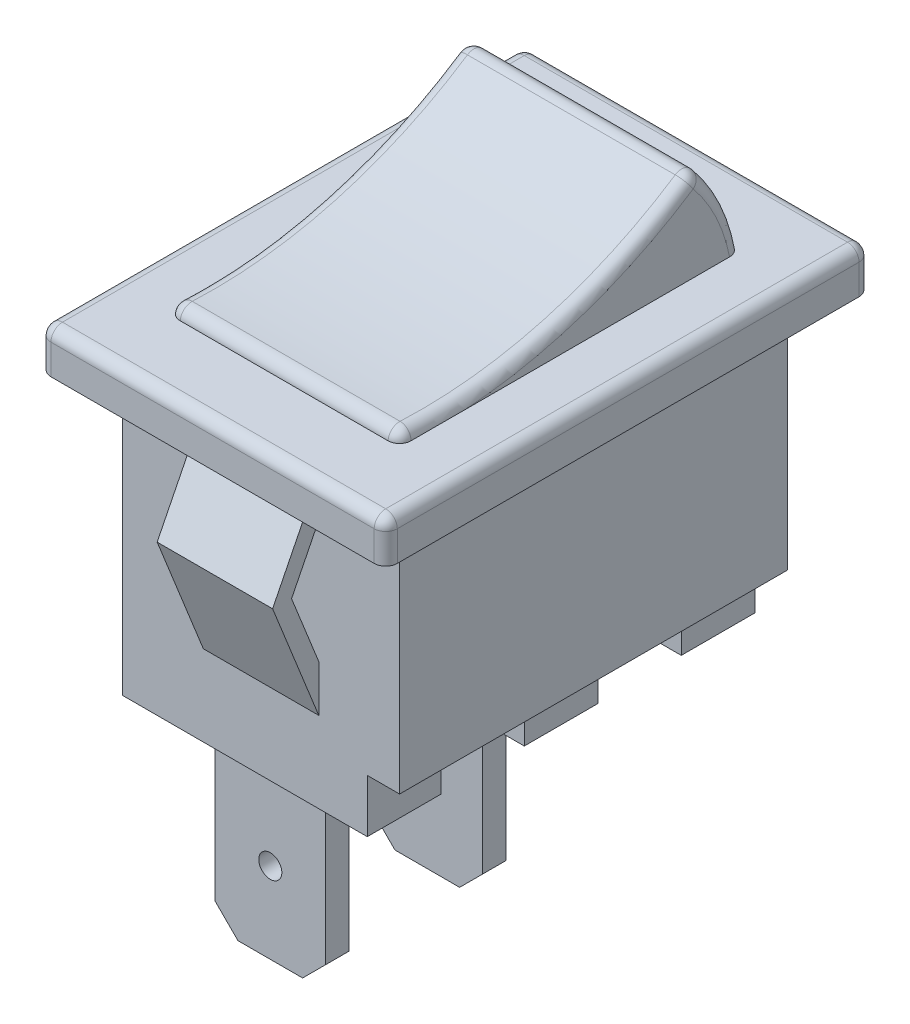
from build123d import *

# Parameters (mm, degrees)
SKETCH1_W           = 15
SKETCH1_H           = 21
BOSS_EXTRUDE1_DEPTH = 1.8
SKETCH2_W           = 12
SKETCH2_H           = 16.8
BOSS_EXTRUDE2_DEPTH = 10.2
SKETCH3_W           = 10.6
SKETCH3_H           = 3.2
SKETCH3_W_2         = 6.5
SKETCH3_H_2         = 1
BOSS_EXTRUDE3_DEPTH = 2.3
SKETCH4_R           = 0.5
BOSS_EXTRUDE4_DEPTH = 1
EXTRUDE_THIN1_DEPTH = 2.5
BOSS_EXTRUDE5_DEPTH = 5
FILLET1_R           = 0.5
FILLET2_R           = 0.5


with BuildPart() as part:
    # Sketch1 → Boss-Extrude1 (new body)
    with BuildSketch(Plane(origin=(0, 0, 0), x_dir=(1, 0, 0), z_dir=(0, 1, 0))):
        Rectangle(SKETCH1_W, SKETCH1_H)
    extrude(amount=BOSS_EXTRUDE1_DEPTH)

    # Sketch2 → Boss-Extrude2 (add)
    with BuildSketch(Plane(origin=(0, 0, 0), x_dir=(1, 0, 0), z_dir=(0, 1, 0))):
        Rectangle(SKETCH2_W, SKETCH2_H)
    extrude(amount=-BOSS_EXTRUDE2_DEPTH)

    # Sketch3 → Boss-Extrude3 (add)
    # profile 1 of 3: a face of its own
    with BuildSketch(Plane.XZ.offset(10.2)):
        with Locations((-0.7, 6.8)):
            Rectangle(SKETCH3_W, SKETCH3_H)
        with Locations((-0.7, 6.8)):
            Rectangle(SKETCH3_W_2, SKETCH3_H_2, mode=Mode.SUBTRACT)
    # profile 2 of 3: a face of its own
    with BuildSketch(Plane.XZ.offset(10.2)):
        with Locations((-0.7, -6.8)):
            Rectangle(SKETCH3_W, SKETCH3_H)
        with Locations((-0.7, -6.8)):
            Rectangle(SKETCH3_W_2, SKETCH3_H_2, mode=Mode.SUBTRACT)
    # profile 3 of 3: a face of its own
    with BuildSketch(Plane.XZ.offset(10.2)):
        with Locations((-0.7, 0)):
            Rectangle(SKETCH3_W, SKETCH3_H)
        with Locations((-0.7, 0)):
            Rectangle(SKETCH3_W_2, SKETCH3_H_2, mode=Mode.SUBTRACT)
    extrude(amount=BOSS_EXTRUDE3_DEPTH)

    # Sketch5 → Extrude-Thin1 (add, symmetric)
    with BuildSketch(Plane(origin=(0, 0, 0), x_dir=(0, 0, -1), z_dir=(1, 0, 0))):
        Polygon((-8.4, 0), (-10.4, -4), (-8.4, -9), (-7.703642482, -8.721456993), (-9.57855827, -4.034167523), (-7.729179607, -0.335410197), align=None)
    extrude_thin1 = extrude(amount=EXTRUDE_THIN1_DEPTH, both=True)

    # Mirror2: Extrude-Thin1 across plane
    add(extrude_thin1.mirror(Plane.XY))

    # Sketch6 → Boss-Extrude5 (add, symmetric)
    with BuildSketch(Plane(origin=(0, 0, 0), x_dir=(0, 0, -1), z_dir=(1, 0, 0))):
        with BuildLine():
            Line((-7.4, 2.3), (-7.4, 1.8))
            Line((-7.4, 1.8), (7.4, 1.8))
            ThreePointArc((7.4, 1.8), (6.685191913, 3.942595957), (5.4, 5.8))
            ThreePointArc((5.4, 5.8), (-0.701262123, 2.957472908), (-7.4, 2.3))
        make_face()
    extrude(amount=BOSS_EXTRUDE5_DEPTH, both=True)

    # Fillet1
    # the kernel refuses this fillet: 0.5 mm, written as the material it takes off along each edge
    with BuildSketch(Plane(origin=(6.139155456, 5.8, -5.4), x_dir=(0, -0.7528288222325751, -0.658216350766155), z_dir=(-1, 0, 0))) as fillet1_piece_1:
        with BuildLine():
            CenterArc((0.441422739, 0.499797197), FILLET1_R, 187.744574116, 83.887366527)
            ThreePointArc((-0.054016593, 0.43241865), (-0.025830517, 0.21635645), (0, 0))
            ThreePointArc((0, 0), (0.227831091, -0.003244846), (0.455662182, 0))
        make_face()
    extrude(amount=12.278310911, mode=Mode.SUBTRACT)
    with BuildSketch(Plane(origin=(7.5, -1.25, -10.5), x_dir=(0, 0, 1), z_dir=(0, 1, 0)), Plane(origin=(7.5, -1.25, 10.5), x_dir=(-1, 0, 0), z_dir=(0, 1, 0))) as fillet1_piece_2:
        with BuildLine():
            CenterArc((FILLET1_R, -FILLET1_R), FILLET1_R, 90, 90)
            Line((0, -FILLET1_R), (0, 0))
            Line((0, 0), (FILLET1_R, 0))
        make_face()
    extrude(amount=4.3, mode=Mode.SUBTRACT)
    with BuildSketch(Plane(origin=(-7.5, -1.25, 10.5), x_dir=(1, 0, 0), z_dir=(0, 1, 0)), Plane(origin=(-7.5, -1.25, -10.5), x_dir=(0, 0, 1), z_dir=(0, 1, 0))) as fillet1_piece_3:
        with BuildLine():
            CenterArc((FILLET1_R, FILLET1_R), FILLET1_R, 180, 90)
            Line((0, FILLET1_R), (0, 0))
            Line((0, 0), (FILLET1_R, 0))
        make_face()
    extrude(amount=4.3, mode=Mode.SUBTRACT)
    with BuildSketch(Plane(origin=(6.324787276, 2.3, 7.4), x_dir=(0, -1, 0), z_dir=(-1, 0, 0))) as fillet1_piece_4_section:
        with BuildLine():
            CenterArc((0.529914911, -0.5), FILLET1_R, 90, 92.582364675)
            ThreePointArc((0.030422668, -0.522527754), (0.016920767, -0.26116435), (0, 0))
            Line((0, 0), (0.529914911, 0))
        make_face()
    fillet1_piece_4 = extrude(amount=12.649574553, mode=Mode.PRIVATE)
    fillet1_piece_4 = split(fillet1_piece_4, bisect_by=Plane(origin=(0, 1.8, 7.280360026), z_dir=(0, 1, 0)), keep=Keep.TOP, mode=Mode.PRIVATE)
    add(fillet1_piece_4, mode=Mode.SUBTRACT)

    # Fillet2
    # the kernel refuses this fillet: 0.5 mm, written as the material it takes off along each edge
    with BuildSketch(Plane(origin=(-5, 0.364887193, 0.470225615), x_dir=(0, 0.024106503791178756, -0.999709396012144), z_dir=(0, -0.999709396012144, -0.024106503791178756))) as fillet2_piece_1_section:
        with BuildLine():
            CenterArc((8 - FILLET2_R, FILLET2_R), FILLET2_R, 270, 90)
            Line((8 - FILLET2_R, 0), (8, 0))
            Line((8, 0), (8, FILLET2_R))
        make_face()
    fillet2_piece_1 = revolve(axis=Axis((-5, 0.364887193, 0.470225615), (1, 0, 0)), revolution_arc=38.150707639, mode=Mode.PRIVATE)
    fillet2_piece_1 = split(fillet2_piece_1, bisect_by=Plane(origin=(-4.858036818, 1.8, -6.655446505), z_dir=(0, 1, 0)), keep=Keep.TOP, mode=Mode.PRIVATE)
    add(fillet2_piece_1, mode=Mode.SUBTRACT)
    with BuildSketch(Plane(origin=(5, 0.364887193, 0.470225615), x_dir=(0, 0.024106503791178756, -0.999709396012144), z_dir=(0, -0.999709396012144, -0.024106503791178756))) as fillet2_piece_2_section:
        with BuildLine():
            CenterArc((8 - FILLET2_R, -FILLET2_R), FILLET2_R, 0, 90)
            Line((8, -FILLET2_R), (8, 0))
            Line((8, 0), (8 - FILLET2_R, 0))
        make_face()
    fillet2_piece_2 = revolve(axis=Axis((5, 0.364887193, 0.470225615), (1, 0, 0)), revolution_arc=38.150707639, mode=Mode.PRIVATE)
    fillet2_piece_2 = split(fillet2_piece_2, bisect_by=Plane(origin=(4.858036818, 1.8, -6.655446505), z_dir=(0, 1, 0)), keep=Keep.TOP, mode=Mode.PRIVATE)
    add(fillet2_piece_2, mode=Mode.SUBTRACT)
    with BuildSketch(Plane(origin=(-5, 22.249267031, 5.976362079), x_dir=(0, -0.8346613404304445, -0.5507635125812654), z_dir=(0, 0.5507635125812654, -0.8346613404304445))) as fillet2_piece_3_section:
        with BuildLine():
            CenterArc((20 + FILLET2_R, -FILLET2_R), FILLET2_R, 90, 90)
            Line((20, -FILLET2_R), (20, 0))
            Line((20, 0), (20 + FILLET2_R, 0))
        make_face()
    fillet2_piece_3 = revolve(axis=Axis((-5, 22.249267031, 5.976362079), (-1, 0, 0)), revolution_arc=36.001773577, mode=Mode.PRIVATE)
    fillet2_piece_3 = split(fillet2_piece_3, bisect_by=Plane(origin=(-4.860130529, 1.8, 0.621819924), z_dir=(0, 1, 0)), keep=Keep.TOP, mode=Mode.PRIVATE)
    add(fillet2_piece_3, mode=Mode.SUBTRACT)
    with BuildSketch(Plane(origin=(-5, 5.138709552, -5.314289929), x_dir=(0, 0.6365096479350569, -0.7712687392119495), z_dir=(0, -0.7712687392119495, -0.6365096479350569))) as fillet2_piece_4:
        with BuildLine():
            CenterArc((0.5 - FILLET2_R, FILLET2_R), FILLET2_R, 270, 90)
            Line((0.5, FILLET2_R), (0.5, 0))
            Line((0.5, 0), (0.5 - FILLET2_R, 0))
        make_face()
    revolve(axis=Axis((-5, 5.138709552, -5.314289929), (1, 0, 0)), revolution_arc=83.887366527, mode=Mode.SUBTRACT)
    with BuildSketch(Plane(origin=(-5, 1.770085089, 6.9), x_dir=(0, 0.998984484948098, -0.04505550835340167), z_dir=(0, -0.04505550835340167, -0.998984484948098))) as fillet2_piece_5_section:
        with BuildLine():
            CenterArc((0.5 - FILLET2_R, FILLET2_R), FILLET2_R, 270, 90)
            Line((0.5, FILLET2_R), (0.5, 0))
            Line((0.5, 0), (0.5 - FILLET2_R, 0))
        make_face()
    fillet2_piece_5 = revolve(axis=Axis((-5, 1.770085089, 6.9), (1, 0, 0)), revolution_arc=232.448230123, mode=Mode.PRIVATE)
    fillet2_piece_5 = split(fillet2_piece_5, bisect_by=Plane(origin=(-4.868015463, 1.8, 7.151178775), z_dir=(0, 1, 0)), keep=Keep.TOP, mode=Mode.PRIVATE)
    add(fillet2_piece_5, mode=Mode.SUBTRACT)
    with BuildSketch(Plane(origin=(5, 22.249267031, 5.976362079), x_dir=(0, -0.8346613404304445, -0.5507635125812654), z_dir=(0, 0.5507635125812654, -0.8346613404304445))) as fillet2_piece_6_section:
        with BuildLine():
            CenterArc((20 + FILLET2_R, FILLET2_R), FILLET2_R, 180, 90)
            Line((20, FILLET2_R), (20, 0))
            Line((20, 0), (20 + FILLET2_R, 0))
        make_face()
    fillet2_piece_6 = revolve(axis=Axis((5, 22.249267031, 5.976362079), (-1, 0, 0)), revolution_arc=36.001773577, mode=Mode.PRIVATE)
    fillet2_piece_6 = split(fillet2_piece_6, bisect_by=Plane(origin=(4.860130529, 1.8, 0.621819924), z_dir=(0, 1, 0)), keep=Keep.TOP, mode=Mode.PRIVATE)
    add(fillet2_piece_6, mode=Mode.SUBTRACT)
    with BuildSketch(Plane(origin=(5, 5.138709552, -5.314289929), x_dir=(0, 0.6365096479350569, -0.7712687392119495), z_dir=(0, -0.7712687392119495, -0.6365096479350569))) as fillet2_piece_7:
        with BuildLine():
            CenterArc((0.5 - FILLET2_R, -FILLET2_R), FILLET2_R, 0, 90)
            Line((0.5, -FILLET2_R), (0.5, 0))
            Line((0.5, 0), (0.5 - FILLET2_R, 0))
        make_face()
    revolve(axis=Axis((5, 5.138709552, -5.314289929), (1, 0, 0)), revolution_arc=83.887366527, mode=Mode.SUBTRACT)
    with BuildSketch(Plane(origin=(5, 1.770085089, 6.9), x_dir=(0, 0.998984484948098, -0.04505550835340167), z_dir=(0, -0.04505550835340167, -0.998984484948098))) as fillet2_piece_8_section:
        with BuildLine():
            CenterArc((0.5 - FILLET2_R, -FILLET2_R), FILLET2_R, 0, 90)
            Line((0.5, -FILLET2_R), (0.5, 0))
            Line((0.5, 0), (0.5 - FILLET2_R, 0))
        make_face()
    fillet2_piece_8 = revolve(axis=Axis((5, 1.770085089, 6.9), (1, 0, 0)), revolution_arc=232.448230123, mode=Mode.PRIVATE)
    fillet2_piece_8 = split(fillet2_piece_8, bisect_by=Plane(origin=(4.868015462, 1.8, 7.151178777), z_dir=(0, 1, 0)), keep=Keep.TOP, mode=Mode.PRIVATE)
    add(fillet2_piece_8, mode=Mode.SUBTRACT)
    with BuildSketch(Plane(origin=(7, 1.8, -10.5), x_dir=(0, 0, 1), z_dir=(-1, 0, 0))) as fillet2_piece_9:
        with BuildLine():
            CenterArc((FILLET2_R, -FILLET2_R), FILLET2_R, 90, 90)
            Line((0, -FILLET2_R), (0, 0))
            Line((0, 0), (FILLET2_R, 0))
        make_face()
    extrude(amount=14, mode=Mode.SUBTRACT)
    with BuildSketch(Plane(origin=(7.5, 1.8, 10), x_dir=(-1, 0, 0), z_dir=(0, 0, -1)), Plane(origin=(-7.5, 1.8, -10), x_dir=(1, 0, 0), z_dir=(0, 0, 1))) as fillet2_piece_10:
        with BuildLine():
            CenterArc((FILLET2_R, -FILLET2_R), FILLET2_R, 90, 90)
            Line((0, -FILLET2_R), (0, 0))
            Line((0, 0), (FILLET2_R, 0))
        make_face()
    extrude(amount=20, mode=Mode.SUBTRACT)
    with BuildSketch(Plane(origin=(-7, 1.8, 10.5), x_dir=(0, -1, 0), z_dir=(1, 0, 0))) as fillet2_piece_11:
        with BuildLine():
            CenterArc((FILLET2_R, FILLET2_R), FILLET2_R, 180, 90)
            Line((0, FILLET2_R), (0, 0))
            Line((0, 0), (FILLET2_R, 0))
        make_face()
    extrude(amount=14, mode=Mode.SUBTRACT)
    with BuildSketch(Plane(origin=(-7, 1.8, -10), x_dir=(-1, 0, 0), z_dir=(0, 0, 1))) as fillet2_piece_12:
        with BuildLine():
            CenterArc((0.5 - FILLET2_R, FILLET2_R), FILLET2_R, 270, 90)
            Line((0.5, FILLET2_R), (0.5, 0))
            Line((0.5, 0), (0.5 - FILLET2_R, 0))
        make_face()
    revolve(axis=Axis((-7, 1.8, -10), (0, -1, 0)), revolution_arc=90, mode=Mode.SUBTRACT)
    with BuildSketch(Plane(origin=(-7, 1.8, 10), x_dir=(0, 0, 1), z_dir=(1, 0, 0))) as fillet2_piece_13:
        with BuildLine():
            CenterArc((0.5 - FILLET2_R, FILLET2_R), FILLET2_R, 270, 90)
            Line((0.5, FILLET2_R), (0.5, 0))
            Line((0.5, 0), (0.5 - FILLET2_R, 0))
        make_face()
    revolve(axis=Axis((-7, 1.8, 10), (0, -1, 0)), revolution_arc=90, mode=Mode.SUBTRACT)
    with BuildSketch(Plane(origin=(7, 1.8, 10), x_dir=(1, 0, 0), z_dir=(0, 0, -1))) as fillet2_piece_14:
        with BuildLine():
            CenterArc((0.5 - FILLET2_R, FILLET2_R), FILLET2_R, 270, 90)
            Line((0.5 - FILLET2_R, 0), (0.5, 0))
            Line((0.5, 0), (0.5, FILLET2_R))
        make_face()
    revolve(axis=Axis((7, 1.8, 10), (0, -1, 0)), revolution_arc=90, mode=Mode.SUBTRACT)
    with BuildSketch(Plane(origin=(7, 1.8, -10), x_dir=(0, 0, -1), z_dir=(-1, 0, 0))) as fillet2_piece_15:
        with BuildLine():
            CenterArc((0.5 - FILLET2_R, FILLET2_R), FILLET2_R, 270, 90)
            Line((0.5, FILLET2_R), (0.5, 0))
            Line((0.5, 0), (0.5 - FILLET2_R, 0))
        make_face()
    revolve(axis=Axis((7, 1.8, -10), (0, -1, 0)), revolution_arc=90, mode=Mode.SUBTRACT)


with BuildPart() as body_2:
    # Sketch4 → Boss-Extrude4 (new body)
    with BuildSketch(Plane.XY.offset(-0.5)):
        Polygon((1.7, -10.2), (-3.1, -10.2), (-3.1, -19.3), (-2.1, -20.3), (0.7, -20.3), (1.7, -19.3), align=None)
        with Locations((-0.7, -16.8)):
            Circle(SKETCH4_R, mode=Mode.SUBTRACT)
    extrude(amount=BOSS_EXTRUDE4_DEPTH)


with BuildPart() as body_3:
    # Mirror1: mirrored copy
    add(body_2.part.mirror(Plane.XY.offset(3.4)))


solid = Compound([part.part, body_2.part, body_3.part])
